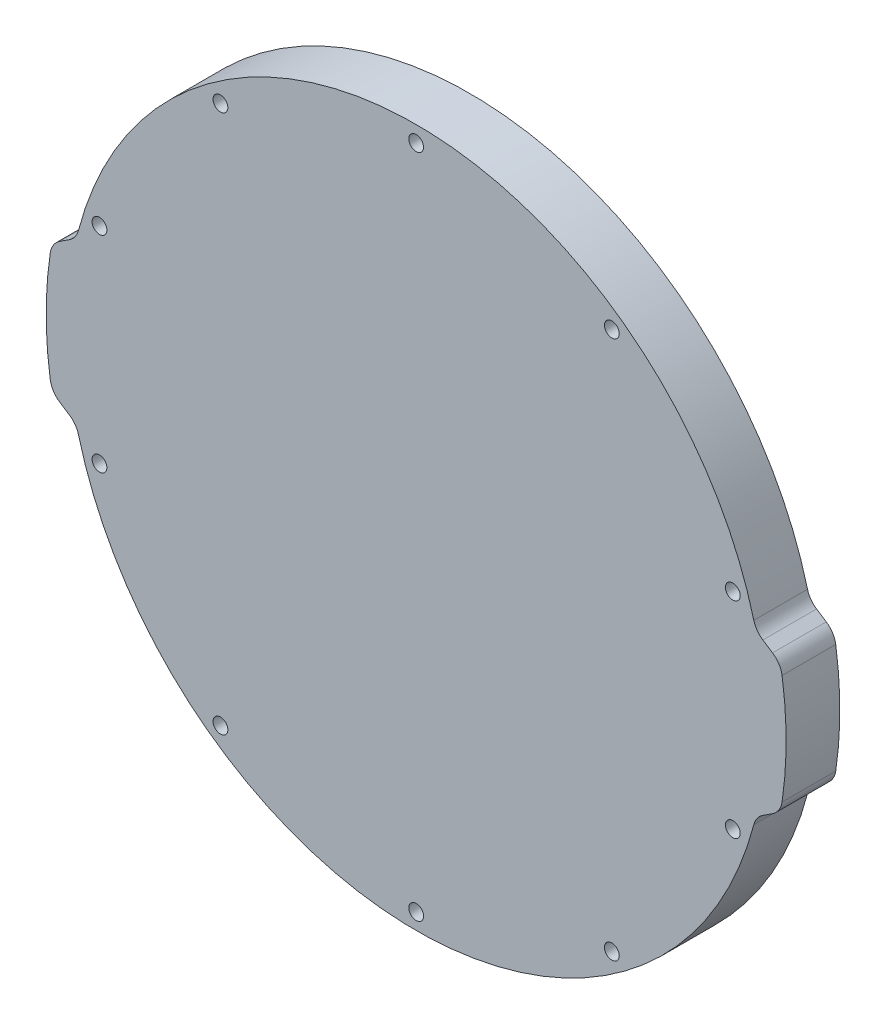
from build123d import *

# Parameters (mm, degrees)
SKETCH1_R           = 1.75
BOSS_EXTRUDE1_DEPTH = 6.35
FILLET1_R           = 5.08


with BuildPart() as part:
    # Sketch1 → Boss-Extrude1 (new, symmetric)
    with BuildSketch(Plane.XY):
        with BuildLine():
            Line((-80.321852568, 19.05), (-86.162592811, 15.24))
            ThreePointArc((-86.162592811, 15.24), (-87.5, 0), (-86.162592811, -15.24))
            Line((-86.162592811, -15.24), (-80.321852568, -19.05))
            ThreePointArc((-80.321852568, -19.05), (0, -82.55), (80.321852568, -19.05))
            Line((80.321852568, -19.05), (86.162592811, -15.24))
            ThreePointArc((86.162592811, -15.24), (87.5, 0), (86.162592811, 15.24))
            Line((86.162592811, 15.24), (80.321852568, 19.05))
            ThreePointArc((80.321852568, 19.05), (0, 82.55), (-80.321852568, 19.05))
        make_face()
        with Locations((-46.282210766, -63.701998137)):
            Circle(SKETCH1_R, mode=Mode.SUBTRACT)
        with Locations((-74.886190093, -24.331998137)):
            Circle(SKETCH1_R, mode=Mode.SUBTRACT)
        with Locations((0, -78.74)):
            Circle(SKETCH1_R, mode=Mode.SUBTRACT)
        with Locations((46.282210766, -63.701998137)):
            Circle(SKETCH1_R, mode=Mode.SUBTRACT)
        with Locations((74.886190093, -24.331998137)):
            Circle(SKETCH1_R, mode=Mode.SUBTRACT)
        with Locations((-74.886190093, 24.331998137)):
            Circle(SKETCH1_R, mode=Mode.SUBTRACT)
        with Locations((-46.282210766, 63.701998137)):
            Circle(SKETCH1_R, mode=Mode.SUBTRACT)
        with Locations((74.886190093, 24.331998137)):
            Circle(SKETCH1_R, mode=Mode.SUBTRACT)
        with Locations((0, 78.74)):
            Circle(SKETCH1_R, mode=Mode.SUBTRACT)
        with Locations((46.282210766, 63.701998137)):
            Circle(SKETCH1_R, mode=Mode.SUBTRACT)
    extrude(amount=BOSS_EXTRUDE1_DEPTH, both=True)

    # Fillet1
    fillet1_edges = [part.edges().sort_by_distance(p)[0] for p in [
        (-86.162592811, 15.24, 0),
        (-80.321852568, 19.05, 0),
        (-86.162592811, -15.24, 0),
        (-80.321852568, -19.05, 0),
        (86.162592811, -15.24, 0),
        (80.321852568, -19.05, 0),
        (86.162592811, 15.24, 0),
        (80.321852568, 19.05, 0),
    ]]
    fillet(fillet1_edges, radius=FILLET1_R)


solid = part.part
